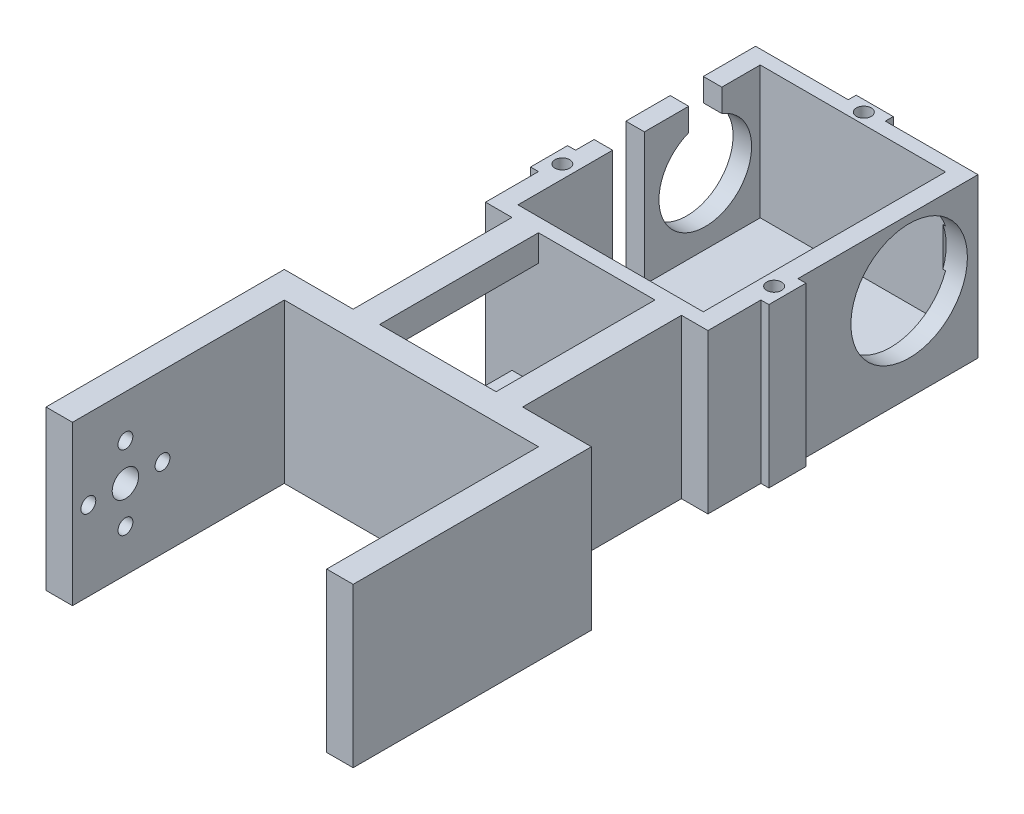
from build123d import *

# Parameters (mm, degrees)
BOSS_EXTRUDE1_DEPTH = 5
SKETCH3_W           = 42
SKETCH3_H           = 51
SKETCH3_W_2         = 35
SKETCH3_H_2         = 45.75
BOSS_EXTRUDE3_DEPTH = 25
SKETCH4_R           = 8.75
CUT_EXTRUDE2_DEPTH  = 5
CUT_EXTRUDE3_DEPTH  = 4
SKETCH7_W           = 6
SKETCH7_H           = 25
CUT_EXTRUDE4_DEPTH  = 4
SKETCH9_R           = 11
CUT_EXTRUDE5_DEPTH  = 4
SKETCH16_W          = 7
SKETCH16_H          = 30
BOSS_EXTRUDE5_DEPTH = 1.5
SKETCH17_W          = 7
SKETCH17_H          = 30
BOSS_EXTRUDE6_DEPTH = 1.5
SKETCH19_W          = 7
SKETCH19_H          = 30
BOSS_EXTRUDE7_DEPTH = 1.5
SKETCH18_R          = 1.4
CUT_EXTRUDE7_DEPTH  = 6
SKETCH1_3_W         = 5
SKETCH1_3_H         = 30
SKETCH1_3_H_2       = 40
BOSS_EXTRUDE8_DEPTH = 30
SKETCH21_R          = 2.95
BOSS_EXTRUDE9_DEPTH = 4
SKETCH24_W          = 30
SKETCH24_H          = 20
CUT_EXTRUDE8_DEPTH  = 30
SKETCH25_R          = 2.5
SKETCH25_R_2        = 1.4
CUT_EXTRUDE9_DEPTH  = 5


with BuildPart() as part:
    # Sketch1 → Boss-Extrude1 (new body)
    with BuildSketch(Plane(origin=(0, 0, 0), x_dir=(1, 0, 0), z_dir=(0, 1, 0))):
        Polygon((21, 25.5), (-21, 25.5), (-21, -25.5), (-16, -25.5), (-11, -25.5), (11, -25.5), (16, -25.5), (21, -25.5), align=None)
    extrude(amount=BOSS_EXTRUDE1_DEPTH)

    # Sketch3 → Boss-Extrude3 (add)
    with BuildSketch(Plane(origin=(0, 5, 0), x_dir=(1, 0, 0), z_dir=(0, 1, 0))):
        Rectangle(SKETCH3_W, SKETCH3_H)
        Rectangle(SKETCH3_W_2, SKETCH3_H_2, mode=Mode.SUBTRACT)
    extrude(amount=BOSS_EXTRUDE3_DEPTH)

    # Sketch4 → Cut-Extrude2 (cut)
    with BuildSketch(Plane.ZY.offset(21)):
        with Locations((-12.5, 17.5)):
            Circle(SKETCH4_R)
    extrude(amount=-CUT_EXTRUDE2_DEPTH, mode=Mode.SUBTRACT)

    # Sketch6 → Cut-Extrude3 (cut)
    with BuildSketch(Plane(origin=(-17.5, 0, 0), x_dir=(0, 0, -1), z_dir=(1, 0, 0))):
        with BuildLine():
            Line((9.375, 17.5), (9.375, 30))
            Line((9.375, 30), (15.625, 30))
            Line((15.625, 30), (15.625, 17.5))
            ThreePointArc((15.625, 17.5), (12.5, 14.375), (9.375, 17.5))
        make_face()
    extrude(amount=-CUT_EXTRUDE3_DEPTH, mode=Mode.SUBTRACT)

    # Sketch7 → Cut-Extrude4 (cut)
    with BuildSketch(Plane.ZY.offset(21)):
        with Locations((2, 17.5)):
            Rectangle(SKETCH7_W, SKETCH7_H)
    extrude(amount=-CUT_EXTRUDE4_DEPTH, mode=Mode.SUBTRACT)

    # Sketch9 → Cut-Extrude5 (cut)
    with BuildSketch(Plane(origin=(21, 0, 0), x_dir=(0, 0, -1), z_dir=(1, 0, 0))):
        with Locations((12.5, 17.5)):
            Circle(SKETCH9_R)
    extrude(amount=-CUT_EXTRUDE5_DEPTH, mode=Mode.SUBTRACT)

    # Sketch16 → Boss-Extrude5 (add)
    with BuildSketch(Plane.ZY.offset(21)):
        with Locations((12, 15)):
            Rectangle(SKETCH16_W, SKETCH16_H)
    extrude(amount=BOSS_EXTRUDE5_DEPTH)

    # Sketch17 → Boss-Extrude6 (add)
    with BuildSketch(Plane(origin=(21, 0, 0), x_dir=(0, 0, -1), z_dir=(1, 0, 0))):
        with Locations((-12, 15)):
            Rectangle(SKETCH17_W, SKETCH17_H)
    extrude(amount=BOSS_EXTRUDE6_DEPTH)

    # Sketch19 → Boss-Extrude7 (add)
    with BuildSketch(Plane(origin=(0, 0, -25.5), x_dir=(-1, 0, 0), z_dir=(0, 0, -1))):
        with Locations((0, 15)):
            Rectangle(SKETCH19_W, SKETCH19_H)
    extrude(amount=BOSS_EXTRUDE7_DEPTH)

    # Sketch18 → Cut-Extrude7 (cut)
    with BuildSketch(Plane(origin=(0, 30, 0), x_dir=(1, 0, 0), z_dir=(0, 1, 0))):
        with Locations((-20, -12)):
            Circle(SKETCH18_R)
        with Locations((20, -12)):
            Circle(SKETCH18_R)
        with Locations((0, 24.9375)):
            Circle(SKETCH18_R)
    extrude(amount=-CUT_EXTRUDE7_DEPTH, mode=Mode.SUBTRACT)

    # Sketch1<3> → Boss-Extrude8 (add)
    with BuildSketch(Plane(origin=(0, 0, 0), x_dir=(1, 0, 0), z_dir=(0, 1, 0))):
        with Locations((-13.5, -40.5)):
            Rectangle(SKETCH1_3_W, SKETCH1_3_H)
        with Locations((13.5, -40.5)):
            Rectangle(SKETCH1_3_W, SKETCH1_3_H)
        Polygon((-11, -55.5), (-16, -55.5), (-29, -55.5), (-29, -60.5), (-24, -60.5), (24, -60.5), (29, -60.5), (29, -55.5), (16, -55.5), (11, -55.5), align=None)
        with Locations((26.5, -80.5)):
            Rectangle(SKETCH1_3_W, SKETCH1_3_H_2)
        with Locations((-26.5, -80.5)):
            Rectangle(SKETCH1_3_W, SKETCH1_3_H_2)
    extrude(amount=BOSS_EXTRUDE8_DEPTH)

    # Sketch21 → Boss-Extrude9 (add)
    with BuildSketch(Plane.ZY.offset(-24)):
        with Locations((90.5, 15)):
            Circle(SKETCH21_R)
    extrude(amount=BOSS_EXTRUDE9_DEPTH)

    # Sketch24 → Cut-Extrude8 (cut)
    with BuildSketch(Plane.ZY.offset(16)):
        with Locations((40.5, 15)):
            Rectangle(SKETCH24_W, SKETCH24_H)
    extrude(amount=-CUT_EXTRUDE8_DEPTH, mode=Mode.SUBTRACT)

    # Sketch25 → Cut-Extrude9 (cut)
    with BuildSketch(Plane.ZY.offset(29)):
        with Locations((90.5, 15)):
            Circle(SKETCH25_R)
        with Locations((90.5, 22)):
            Circle(SKETCH25_R_2)
        with Locations((83.5, 15)):
            Circle(SKETCH25_R_2)
        with Locations((90.5, 8)):
            Circle(SKETCH25_R_2)
        with Locations((97.5, 15)):
            Circle(SKETCH25_R_2)
    extrude(amount=-CUT_EXTRUDE9_DEPTH, mode=Mode.SUBTRACT)


solid = part.part
